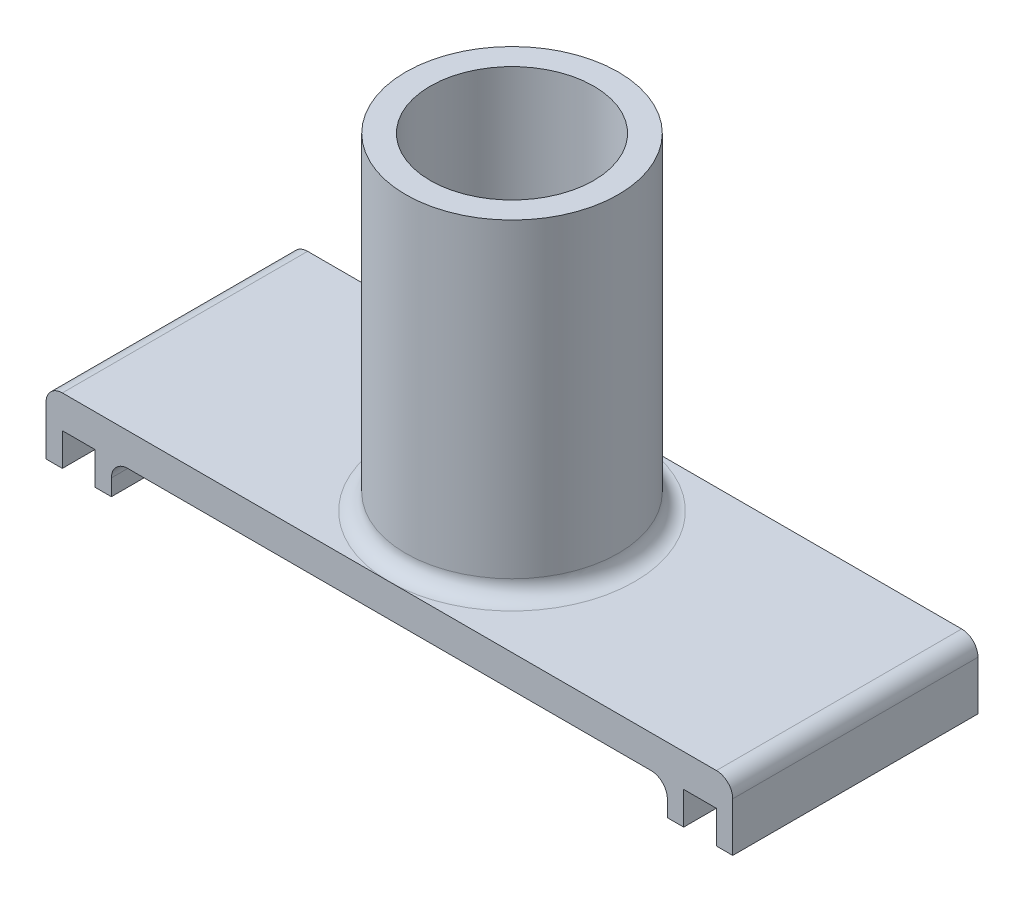
from build123d import *

# Parameters (mm, degrees)
SKETCH1_W           = 420
SKETCH1_H           = 150
BOSS_EXTRUDE1_DEPTH = 20
SKETCH2_W           = 10
SKETCH2_H           = 150
BOSS_EXTRUDE3_DEPTH = 20
FILLET1_R           = 10
FILLET2_R           = 10
FILLET3_R           = 10
FILLET4_R           = 10
SKETCH3_R           = 65
SKETCH3_R_2         = 50
BOSS_EXTRUDE4_DEPTH = 200
FILLET5_R           = 10
CUT_EXTRUDE1_START  = -327
SKETCH4_R           = 50
CUT_EXTRUDE1_DEPTH  = 327


with BuildPart() as part:
    # Sketch1 → Boss-Extrude1 (new body)
    with BuildSketch(Plane(origin=(0, 0, 0), x_dir=(1, 0, 0), z_dir=(0, 1, 0))):
        Rectangle(SKETCH1_W, SKETCH1_H)
    extrude(amount=BOSS_EXTRUDE1_DEPTH)

    # Sketch2 → Boss-Extrude3 (add)
    with BuildSketch(Plane.XZ):
        with Locations((-205, 0)):
            Rectangle(SKETCH2_W, SKETCH2_H)
        with Locations((-175, 0)):
            Rectangle(SKETCH2_W, SKETCH2_H)
        with Locations((205, 0)):
            Rectangle(SKETCH2_W, SKETCH2_H)
        with Locations((175, 0)):
            Rectangle(SKETCH2_W, SKETCH2_H)
    extrude(amount=BOSS_EXTRUDE3_DEPTH)

    # Fillet1
    fillet1_edges = [part.edges().sort_by_distance(p)[0] for p in [
        (-170, 0, 0),
    ]]
    fillet(fillet1_edges, radius=FILLET1_R)

    # Fillet2
    fillet2_edges = [part.edges().sort_by_distance(p)[0] for p in [
        (170, 0, 0),
    ]]
    fillet(fillet2_edges, radius=FILLET2_R)

    # Fillet3
    fillet3_edges = [part.edges().sort_by_distance(p)[0] for p in [
        (210, 20, 0),
    ]]
    fillet(fillet3_edges, radius=FILLET3_R)

    # Fillet4
    fillet4_edges = [part.edges().sort_by_distance(p)[0] for p in [
        (-210, 20, 0),
    ]]
    fillet(fillet4_edges, radius=FILLET4_R)

    # Sketch3 → Boss-Extrude4 (add)
    with BuildSketch(Plane(origin=(0, 20, 0), x_dir=(1, 0, 0), z_dir=(0, 1, 0))):
        with Locations(Location((0, 0, 0), (0, 0, 90))):
            Circle(SKETCH3_R)
        with Locations(Location((0, 0, 0), (0, 0, 270))):
            Circle(SKETCH3_R_2, mode=Mode.SUBTRACT)
    extrude(amount=BOSS_EXTRUDE4_DEPTH)

    # Fillet5
    fillet5_edges = [part.edges().sort_by_distance(p)[0] for p in [
        (0, 20, 65),
    ]]
    fillet(fillet5_edges, radius=FILLET5_R - 0.0001)  # a hair under: the kernel refuses the full size

    # Sketch4 → Cut-Extrude1 (cut)
    with BuildSketch(Plane(origin=(0, 220, 0), x_dir=(1, 0, 0), z_dir=(0, 1, 0)).offset(CUT_EXTRUDE1_START)):
        with Locations(Location((0, 0, 0), (0, 0, 90))):
            Circle(SKETCH4_R)
    extrude(amount=CUT_EXTRUDE1_DEPTH, mode=Mode.SUBTRACT)


solid = part.part
